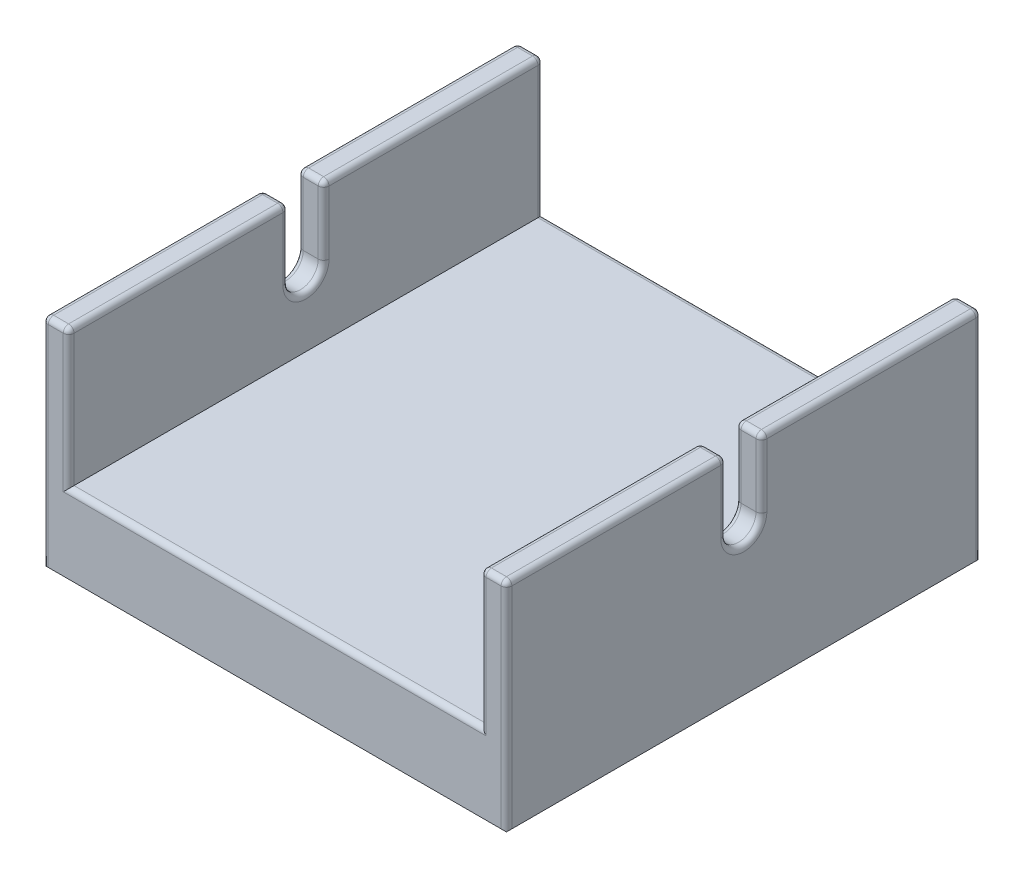
from build123d import *

# Parameters (mm, degrees)
SKETCH2_W           = 85.7504
SKETCH2_H           = 87.8
BOSS_EXTRUDE1_DEPTH = 15
SKETCH2_3_W         = 4.7752
SKETCH2_3_H         = 87.8
BOSS_EXTRUDE2_DEPTH = 25.4
CUT_EXTRUDE1_DEPTH  = 137.346364455
CHAMFER1_SIZE       = 0.5
FILLET2_R           = 1


with BuildPart() as part:
    # Sketch2 → Boss-Extrude1 (new body)
    with BuildSketch(Plane(origin=(0, 34, 0), x_dir=(-1, 0, 0), z_dir=(0, -1, 0))):
        with Locations((-150, -43.9)):
            Rectangle(SKETCH2_W, SKETCH2_H)
    extrude(amount=BOSS_EXTRUDE1_DEPTH)

    # Sketch2<3> → Boss-Extrude2 (add)
    with BuildSketch(Plane(origin=(0, 34, 0), x_dir=(-1, 0, 0), z_dir=(0, -1, 0))):
        with Locations((-109.5124, -43.9)):
            Rectangle(SKETCH2_3_W, SKETCH2_3_H)
        with Locations((-190.4876, -43.9)):
            Rectangle(SKETCH2_3_W, SKETCH2_3_H)
    extrude(amount=-BOSS_EXTRUDE2_DEPTH)

    # Sketch3 → Cut-Extrude1 (cut, through all)
    with BuildSketch(Plane(origin=(192.8752, 0, 0), x_dir=(0, 0, -1), z_dir=(1, 0, 0))):
        with BuildLine():
            Line((-47.1639, 46.7), (-47.1639, 59.4))
            Line((-47.1639, 59.4), (-40.6361, 59.4))
            Line((-40.6361, 59.4), (-40.6361, 46.7))
            ThreePointArc((-40.6361, 46.7), (-43.9, 43.4361), (-47.1639, 46.7))
        make_face()
    extrude(amount=-CUT_EXTRUDE1_DEPTH, mode=Mode.SUBTRACT)

    # Chamfer1
    chamfer1_edges = [part.edges().sort_by_distance(p)[0] for p in [
        (150, 19, 87.8),
        (192.8752, 19, 43.9),
        (150, 19, 0),
        (107.1248, 19, 43.9),
    ]]
    chamfer(chamfer1_edges, length=CHAMFER1_SIZE)

    # Fillet2
    fillet2_edges = [part.edges().sort_by_distance(p)[0] for p in [
        (111.9, 53.05, 40.6361),
        (111.9, 43.4361, 43.9),
        (107.1248, 53.05, 40.6361),
        (107.1248, 43.4361, 43.9),
        (192.8752, 53.05, 40.6361),
        (192.8752, 43.4361, 43.9),
        (188.1, 53.05, 40.6361),
        (188.1, 43.4361, 43.9),
        (109.5124, 59.4, 0),
        (111.9, 59.4, 20.31805),
        (109.5124, 59.4, 40.6361),
        (107.1248, 59.4, 20.31805),
        (109.5124, 59.4, 87.8),
        (107.1248, 59.4, 67.48195),
        (111.9, 59.4, 67.48195),
        (190.4876, 59.4, 0),
        (192.8752, 59.4, 20.31805),
        (190.4876, 59.4, 40.6361),
        (188.1, 59.4, 20.31805),
        (190.4876, 59.4, 87.8),
        (188.1, 59.4, 67.48195),
        (192.8752, 59.4, 67.48195),
        (111.9, 53.05, 47.1639),
        (109.5124, 59.4, 47.1639),
        (107.1248, 53.05, 47.1639),
        (192.8752, 53.05, 47.1639),
        (190.4876, 59.4, 47.1639),
        (188.1, 53.05, 47.1639),
        (150, 34, 87.8),
        (107.1248, 39.45, 87.8),
        (188.1, 46.7, 87.8),
        (111.9, 46.7, 87.8),
        (192.8752, 39.45, 87.8),
        (107.1248, 39.45, 0),
        (192.8752, 39.45, 0),
        (188.1, 46.7, 0),
        (150, 34, 0),
        (111.9, 46.7, 0),
    ]]
    fillet(fillet2_edges, radius=FILLET2_R)


solid = part.part
